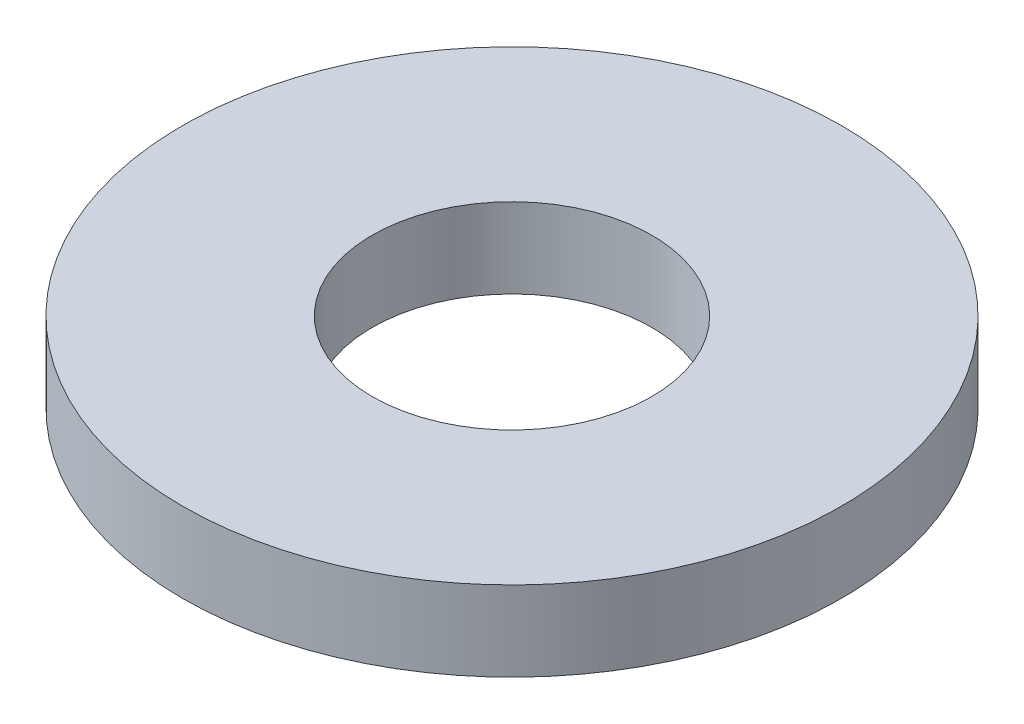
from build123d import *

# Parameters (mm, degrees)
SKETCH1_R           = 82.5
BOSS_EXTRUDE1_DEPTH = 20
SKETCH2_R           = 35
CUT_EXTRUDE1_DEPTH  = 119.374406018


with BuildPart() as part:
    # Sketch1 → Boss-Extrude1 (new body)
    with BuildSketch(Plane(origin=(0, 0, 0), x_dir=(1, 0, 0), z_dir=(0, 1, 0))):
        Circle(SKETCH1_R)
    extrude(amount=BOSS_EXTRUDE1_DEPTH)

    # Sketch2 → Cut-Extrude1 (cut, through all)
    with BuildSketch(Plane(origin=(0, 0, 0), x_dir=(1, 0, 0), z_dir=(0, 1, 0))):
        Circle(SKETCH2_R)
    extrude(amount=CUT_EXTRUDE1_DEPTH, mode=Mode.SUBTRACT)


solid = part.part
